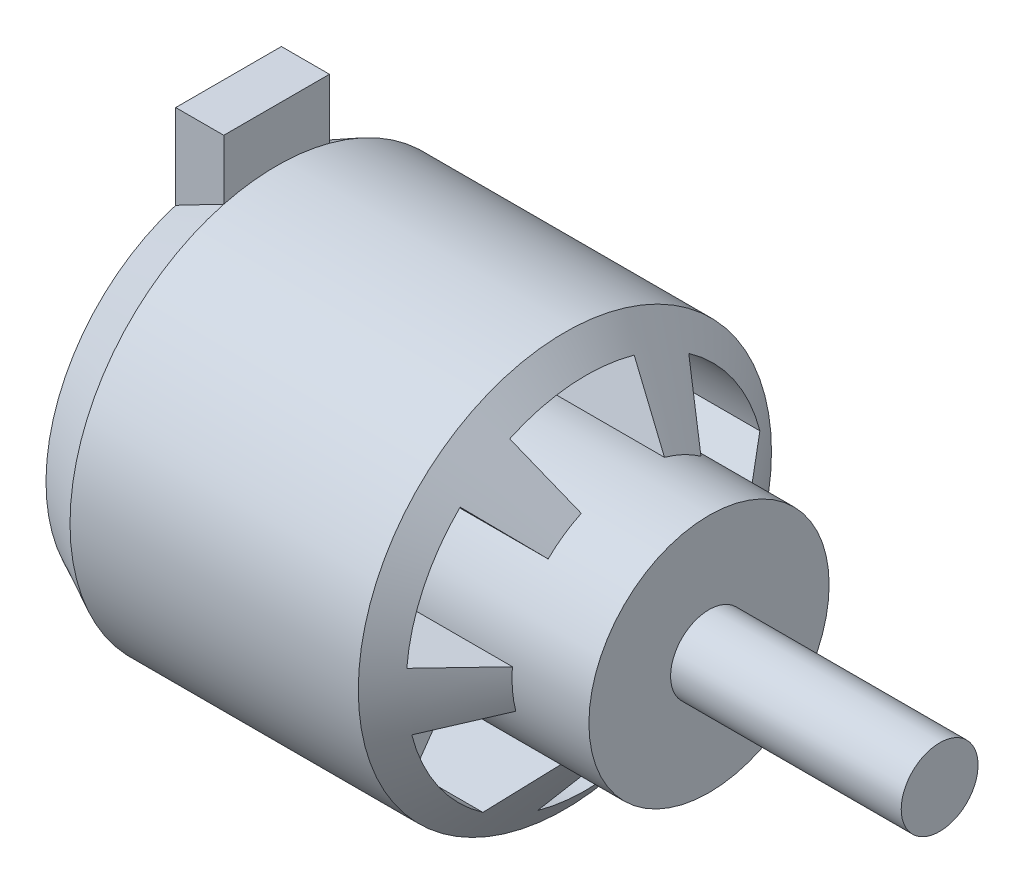
from build123d import *

# Parameters (mm, degrees)
CUT_EXTRUDE1_DEPTH  = 20
SKETCH3_W           = 5
SKETCH3_H           = 11
BOSS_EXTRUDE1_DEPTH = 27


with BuildPart() as part:
    # Sketch1 → Revolve1 (revolve)
    with BuildSketch(Plane.XY):
        Polygon((0, 0), (0, 19), (5, 21.5), (35, 21.5), (42, 12.5), (50, 12.5), (50, 4), (74, 4), (74, 0), align=None)
    revolve(axis=Axis((0, 0, 0), (1, 0, 0)))

    # Sketch2 → Cut-Extrude1 (cut)
    with BuildSketch(Plane(origin=(50, 0, 0), x_dir=(0, 0, -1), z_dir=(1, 0, 0))):
        with BuildLine():
            Line((18.630423, -1.611622), (12.453492, -1.077288))
            ThreePointArc((12.453492, -1.077288), (11.3025, -5.338867), (8.741979, -8.93464))
            Line((8.741979, -8.93464), (13.078001, -13.366222))
            ThreePointArc((13.078001, -13.366222), (16.908539, -7.986946), (18.630423, -1.611622))
        make_face()
        with BuildLine():
            Line((7.919506, -16.940231), (5.293787, -11.323684))
            ThreePointArc((5.293787, -11.323684), (1.027655, -12.457685), (-3.366636, -12.038096))
            Line((-3.366636, -12.038096), (-5.036487, -18.008992))
            ThreePointArc((-5.036487, -18.008992), (1.537372, -18.636697), (7.919506, -16.940231))
        make_face()
        with BuildLine():
            Line((-10.710917, -15.328609), (-7.159704, -10.246396))
            ThreePointArc((-7.159704, -10.246396), (-10.274845, -7.118818), (-12.108615, -3.103456))
            Line((-12.108615, -3.103456), (-18.114488, -4.64277))
            ThreePointArc((-18.114488, -4.64277), (-15.371167, -10.649752), (-10.710917, -15.328609))
        make_face()
        with BuildLine():
            Line((-18.630423, 1.611622), (-12.453492, 1.077288))
            ThreePointArc((-12.453492, 1.077288), (-11.3025, 5.338867), (-8.741979, 8.93464))
            Line((-8.741979, 8.93464), (-13.078001, 13.366222))
            ThreePointArc((-13.078001, 13.366222), (-16.908539, 7.986946), (-18.630423, 1.611622))
        make_face()
        with BuildLine():
            Line((-7.919506, 16.940231), (-5.293787, 11.323684))
            ThreePointArc((-5.293787, 11.323684), (-1.027655, 12.457685), (3.366636, 12.038096))
            Line((3.366636, 12.038096), (5.036487, 18.008992))
            ThreePointArc((5.036487, 18.008992), (-1.537372, 18.636697), (-7.919506, 16.940231))
        make_face()
        with BuildLine():
            Line((10.710917, 15.328609), (7.159704, 10.246396))
            ThreePointArc((7.159704, 10.246396), (10.274845, 7.118818), (12.108615, 3.103456))
            Line((12.108615, 3.103456), (18.114488, 4.64277))
            ThreePointArc((18.114488, 4.64277), (15.371167, 10.649752), (10.710917, 15.328609))
        make_face()
    extrude(amount=-CUT_EXTRUDE1_DEPTH, mode=Mode.SUBTRACT)

    # Sketch3 → Boss-Extrude1 (add)
    with BuildSketch(Plane(origin=(0, 0, 0), x_dir=(1, 0, 0), z_dir=(0, 1, 0))):
        with Locations((2.5, 0)):
            Rectangle(SKETCH3_W, SKETCH3_H)
    extrude(amount=BOSS_EXTRUDE1_DEPTH)


solid = part.part
